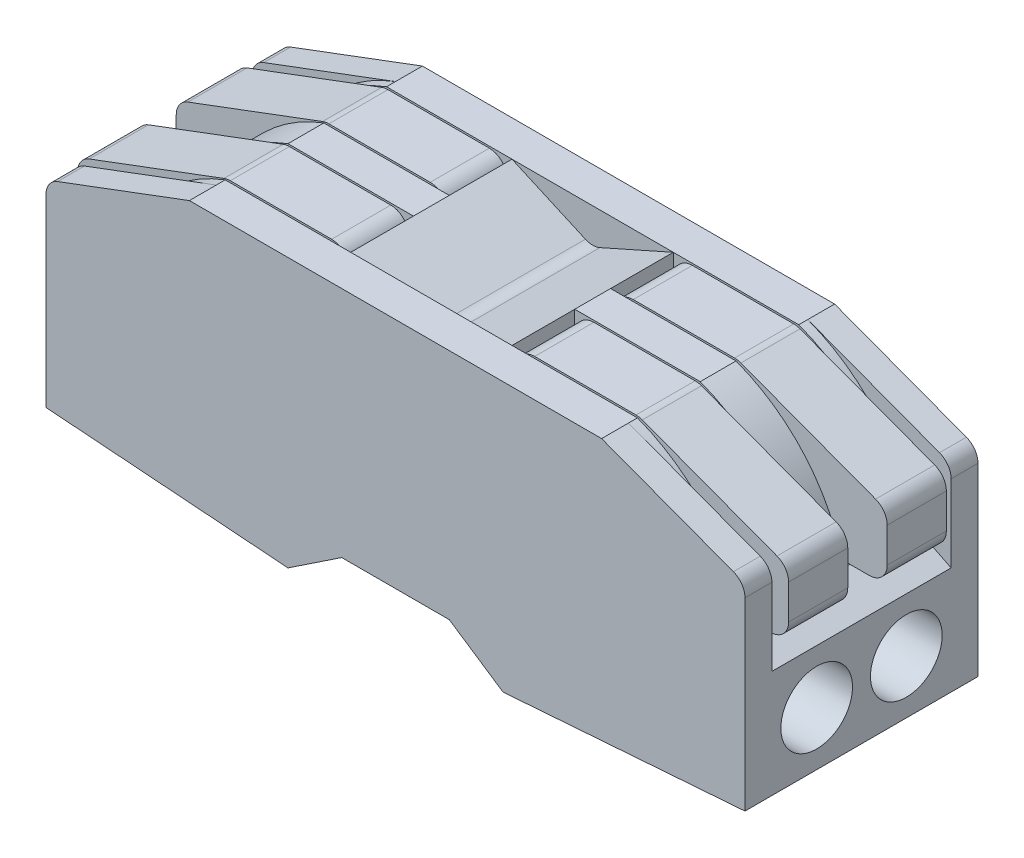
from build123d import *
from OCP.BRepFilletAPI import BRepFilletAPI_MakeChamfer

# Parameters (mm, degrees)
CROQUIS1_W                  = 39
CROQUIS1_H                  = 15
SALIENTE_EXTRUIR1_DEPTH     = 13
CORTAR_EXTRUIR1_DEPTH       = 13
CORTAR_EXTRUIR2_DEPTH       = 25.606909599
CROQUIS4_W                  = 9
CROQUIS4_H                  = 1
CORTAR_EXTRUIR3_DEPTH       = 10
CROQUIS5_W                  = 9
CROQUIS5_H                  = 1
CORTAR_EXTRUIR4_DEPTH       = 10
CORTAR_EXTRUIR5_START       = -2
CORTAR_EXTRUIR5_DEPTH       = 9
CROQUIS7_R                  = 2
CORTAR_EXTRUIR10_DEPTH      = 15
CORTAR_EXTRUIR11_START      = -15
CROQUIS8_R                  = 2
CORTAR_EXTRUIR11_DEPTH      = 15
CROQUIS9_W                  = 15
CROQUIS9_H                  = 3.5
CORTAR_EXTRUIR12_DEPTH      = 7
CORTAR_EXTRUIR13_DEPTH      = 4
CORTAR_EXTRUIR13_DEPTH_BACK = 6
CHAFL_N1_SIZE               = 2
CHAFL_N1_SIZE_2             = 1
SALIENTE_EXTRUIR2_START     = 0.1
SALIENTE_EXTRUIR2_DEPTH     = 3.3
SALIENTE_EXTRUIR2_2_DEPTH   = 3.3
SALIENTE_EXTRUIR3_START     = 2.2
SALIENTE_EXTRUIR3_DEPTH     = 3.3
SALIENTE_EXTRUIR3_2_DEPTH   = 3.3
REDONDEO1_R                 = 1
REDONDEO2_R                 = 1
REDONDEO3_R                 = 1
REDONDEO4_R                 = 1
REDONDEO5_R                 = 1
REDONDEO6_R                 = 1
REDONDEO7_R                 = 1
REDONDEO8_R                 = 1
REDONDEO12_R                = 1
REDONDEO13_R                = 1
REDONDEO14_R                = 1
REDONDEO15_R                = 1
REDONDEO16_R                = 1
REDONDEO17_R                = 1


with BuildPart() as part:
    # Croquis1 → Saliente-Extruir1 (new body)
    with BuildSketch(Plane.XY):
        Rectangle(CROQUIS1_W, CROQUIS1_H)
    extrude(amount=SALIENTE_EXTRUIR1_DEPTH)

    # Croquis2 → Cortar-Extruir1 (cut)
    with BuildSketch(Plane.XY.offset(13)):
        Polygon((0, -5.5), (0, -7.5), (6, -7.5), (3, -5.5), align=None)
        Polygon((-6, -7.5), (0, -7.5), (0, -5.5), (-3, -5.5), align=None)
        Polygon((-19.5, -7.5), (-6, -7.5), (-19.5, -6.5), align=None)
        Polygon((6, -7.5), (19.5, -6.5), (19.5, -7.5), align=None)
    extrude(amount=-CORTAR_EXTRUIR1_DEPTH, mode=Mode.SUBTRACT)

    # Croquis3 → Cortar-Extruir2 (cut, through all)
    with BuildSketch(Plane.XY.offset(13)):
        Polygon((-11.5, 7.5), (-19.5, 4.5), (-19.5, 7.5), align=None)
        Polygon((19.5, 4.5), (19.5, 7.5), (11.5, 7.5), align=None)
    extrude(amount=-CORTAR_EXTRUIR2_DEPTH, mode=Mode.SUBTRACT)

    # Croquis4 → Cortar-Extruir3 (cut)
    with BuildSketch(Plane(origin=(19.5, 0, 0), x_dir=(0, 0, -1), z_dir=(1, 0, 0))):
        with Locations((-6.5, -7)):
            Rectangle(CROQUIS4_W, CROQUIS4_H)
    extrude(amount=-CORTAR_EXTRUIR3_DEPTH, mode=Mode.SUBTRACT)

    # Croquis5 → Cortar-Extruir4 (cut)
    with BuildSketch(Plane.ZY.offset(19.5)):
        with Locations((6.5, -7)):
            Rectangle(CROQUIS5_W, CROQUIS5_H)
    extrude(amount=-CORTAR_EXTRUIR4_DEPTH, mode=Mode.SUBTRACT)

    # Croquis6 → Cortar-Extruir5 (cut)
    with BuildSketch(Plane(origin=(0, 0, 0), x_dir=(-1, 0, 0), z_dir=(0, 0, -1)).offset(CORTAR_EXTRUIR5_START)):
        Polygon((4.5, 7.5), (-4.5, 7.5), (0, 5.5), align=None)
    extrude(amount=-CORTAR_EXTRUIR5_DEPTH, mode=Mode.SUBTRACT)

    # Croquis7 → Cortar-Extruir10 (cut)
    with BuildSketch(Plane.ZY.offset(19.5)):
        with Locations(Location((9, -3.5, 0), (0, 0, 270))):
            Circle(CROQUIS7_R)
        with Locations(Location((4, -3.5, 0), (0, 0, 90))):
            Circle(CROQUIS7_R)
    extrude(amount=-CORTAR_EXTRUIR10_DEPTH, mode=Mode.SUBTRACT)

    # Croquis8 → Cortar-Extruir11 (cut)
    with BuildSketch(Plane(origin=(19.5, 0, 0), x_dir=(0, 0, -1), z_dir=(1, 0, 0)).offset(CORTAR_EXTRUIR11_START)):
        with Locations(Location((-9, -3.5, 0), (0, 0, 270))):
            Circle(CROQUIS8_R)
        with Locations(Location((-4, -3.5, 0), (0, 0, 90))):
            Circle(CROQUIS8_R)
    extrude(amount=CORTAR_EXTRUIR11_DEPTH, mode=Mode.SUBTRACT)

    # Croquis9 → Cortar-Extruir12 (cut)
    with BuildSketch(Plane(origin=(0, 7.5, 0), x_dir=(1, 0, 0), z_dir=(0, 1, 0))):
        with Locations((12, -3.75)):
            Rectangle(CROQUIS9_W, CROQUIS9_H)
        with Locations((-12, -3.75)):
            Rectangle(CROQUIS9_W, CROQUIS9_H)
        with Locations((-12, -9.25)):
            Rectangle(CROQUIS9_W, CROQUIS9_H)
        with Locations((12, -9.25)):
            Rectangle(CROQUIS9_W, CROQUIS9_H)
    extrude(amount=-CORTAR_EXTRUIR12_DEPTH, mode=Mode.SUBTRACT)

    # Croquis10 → Cortar-Extruir13 (cut, two sides: drawn at the far end of the back side and taken through both)
    with BuildSketch(Plane(origin=(0, 0, 5.5), x_dir=(-1, 0, 0), z_dir=(0, 0, -1)).offset(-CORTAR_EXTRUIR13_DEPTH_BACK)):
        with BuildLine():
            Line((17.5, 0.5), (19.5, 0.5))
            Line((19.5, 0.5), (19.5, 4.5))
            Line((19.5, 4.5), (11.5, 7.5))
            ThreePointArc((11.5, 7.5), (15.400036271, 4.771459661), (17.5, 0.5))
        make_face()
        with BuildLine():
            Line((-19.5, 4.5), (-11.5, 7.5))
            ThreePointArc((-11.5, 7.5), (-15.400036271, 4.771459661), (-17.5, 0.5))
            Line((-17.5, 0.5), (-19.5, 0.5))
            Line((-19.5, 0.5), (-19.5, 4.5))
        make_face()
    extrude(amount=CORTAR_EXTRUIR13_DEPTH + CORTAR_EXTRUIR13_DEPTH_BACK, mode=Mode.SUBTRACT)

    # Chaflán1
    chafl_n1_edges_1 = [part.edges().sort_by_distance(p)[0] for p in [
        (-19.5, 0.5, 6.5),
    ]]
    chafl_n1_side_1 = [part.faces().sort_by_distance(p)[0] for p in [
        (-19.48, 0.5, 6.5),
    ]]
    chafl_n1_edges_2 = [part.edges().sort_by_distance(p)[0] for p in [
        (19.5, 0.5, 6.5),
    ]]
    chafl_n1_side_2 = [part.faces().sort_by_distance(p)[0] for p in [
        (19.48, 0.5, 6.5),
    ]]
    chafl_n1 = BRepFilletAPI_MakeChamfer(part.part.solid().wrapped)
    for e in chafl_n1_edges_1:
        chafl_n1.Add(CHAFL_N1_SIZE - 0.0001, CHAFL_N1_SIZE_2 - 0.0001, e.wrapped, chafl_n1_side_1[0].wrapped)
    for e in chafl_n1_edges_2:
        chafl_n1.Add(CHAFL_N1_SIZE - 0.0001, CHAFL_N1_SIZE_2 - 0.0001, e.wrapped, chafl_n1_side_2[0].wrapped)
    add(Compound.cast(chafl_n1.Shape()), mode=Mode.REPLACE)  # a hair under: the kernel refuses the full size

    # Redondeo12
    redondeo12_edges = [part.edges().sort_by_distance(p)[0] for p in [
        (0, 5.5, 6.5),
    ]]
    fillet(redondeo12_edges, radius=REDONDEO12_R)

    # Redondeo13
    redondeo13_edges = [part.edges().sort_by_distance(p)[0] for p in [
        (19.5, 4.5, 12.25),
        (-19.5, 4.5, 12.25),
        (-19.5, 4.5, 0.75),
        (19.5, 4.5, 0.75),
    ]]
    fillet(redondeo13_edges, radius=REDONDEO13_R)


with BuildPart() as body_2:
    # Croquis11 → Saliente-Extruir2 (new body)
    with BuildSketch(Plane.XY.offset(7.5).offset(SALIENTE_EXTRUIR2_START)):
        Polygon((11.5, 7.5), (19.833617862, 4.374893302), (19.833617862, 0.752903639), (4.663883378, 0.752903639), (4.663883378, 7.5), align=None)
    extrude(amount=SALIENTE_EXTRUIR2_DEPTH)

    # Redondeo2
    redondeo2_edges = [body_2.edges().sort_by_distance(p)[0] for p in [
        (4.663883378, 7.5, 9.25),
    ]]
    fillet(redondeo2_edges, radius=REDONDEO2_R)

    # Redondeo7
    redondeo7_edges = [body_2.edges().sort_by_distance(p)[0] for p in [
        (11.5, 7.5, 9.25),
    ]]
    fillet(redondeo7_edges, radius=REDONDEO7_R)

    # Redondeo17
    redondeo17_edges = [body_2.edges().sort_by_distance(p)[0] for p in [
        (19.833617862, 0.752903639, 9.25),
        (19.833617862, 4.374893302, 9.25),
    ]]
    fillet(redondeo17_edges, radius=REDONDEO17_R)


with BuildPart() as body_3:
    # Croquis11 → Saliente-Extruir2 2 (new body)
    with BuildSketch(Plane.XY.offset(7.5).offset(SALIENTE_EXTRUIR2_START)):
        Polygon((-19.833617862, 0.752903639), (-19.833617862, 4.374893302), (-11.5, 7.5), (-4.663883378, 7.5), (-4.663883378, 0.752903639), align=None)
    extrude(amount=SALIENTE_EXTRUIR2_2_DEPTH)

    # Redondeo4
    redondeo4_edges = [body_3.edges().sort_by_distance(p)[0] for p in [
        (-4.663883378, 7.5, 9.25),
    ]]
    fillet(redondeo4_edges, radius=REDONDEO4_R)

    # Redondeo5
    redondeo5_edges = [body_3.edges().sort_by_distance(p)[0] for p in [
        (-11.5, 7.5, 9.25),
    ]]
    fillet(redondeo5_edges, radius=REDONDEO5_R)

    # Redondeo15
    redondeo15_edges = [body_3.edges().sort_by_distance(p)[0] for p in [
        (-19.833617862, 4.374893302, 9.25),
        (-19.833617862, 0.752903639, 9.25),
    ]]
    fillet(redondeo15_edges, radius=REDONDEO15_R)


with BuildPart() as body_4:
    # Croquis12 → Saliente-Extruir3 (new body)
    with BuildSketch(Plane(origin=(0, 0, 7.6), x_dir=(-1, 0, 0), z_dir=(0, 0, -1)).offset(SALIENTE_EXTRUIR3_START)):
        Polygon((11.5, 7.5), (19.833617862, 4.374893302), (19.833617862, 0.752903639), (4.663883378, 0.752903639), (4.663883378, 7.5), align=None)
    extrude(amount=SALIENTE_EXTRUIR3_DEPTH)

    # Redondeo3
    redondeo3_edges = [body_4.edges().sort_by_distance(p)[0] for p in [
        (-4.663883378, 7.5, 3.75),
    ]]
    fillet(redondeo3_edges, radius=REDONDEO3_R)

    # Redondeo6
    redondeo6_edges = [body_4.edges().sort_by_distance(p)[0] for p in [
        (-11.5, 7.5, 3.75),
    ]]
    fillet(redondeo6_edges, radius=REDONDEO6_R)

    # Redondeo14
    redondeo14_edges = [body_4.edges().sort_by_distance(p)[0] for p in [
        (-19.833617862, 0.752903639, 3.75),
        (-19.833617862, 4.374893302, 3.75),
    ]]
    fillet(redondeo14_edges, radius=REDONDEO14_R)


with BuildPart() as body_5:
    # Croquis12 → Saliente-Extruir3 2 (new body)
    with BuildSketch(Plane(origin=(0, 0, 7.6), x_dir=(-1, 0, 0), z_dir=(0, 0, -1)).offset(SALIENTE_EXTRUIR3_START)):
        Polygon((-19.833617862, 0.752903639), (-19.833617862, 4.374893302), (-11.5, 7.5), (-4.663883378, 7.5), (-4.663883378, 0.752903639), align=None)
    extrude(amount=SALIENTE_EXTRUIR3_2_DEPTH)

    # Redondeo1
    redondeo1_edges = [body_5.edges().sort_by_distance(p)[0] for p in [
        (4.663883378, 7.5, 3.75),
    ]]
    fillet(redondeo1_edges, radius=REDONDEO1_R)

    # Redondeo8
    redondeo8_edges = [body_5.edges().sort_by_distance(p)[0] for p in [
        (11.5, 7.5, 3.75),
    ]]
    fillet(redondeo8_edges, radius=REDONDEO8_R)

    # Redondeo16
    redondeo16_edges = [body_5.edges().sort_by_distance(p)[0] for p in [
        (19.833617862, 4.374893302, 3.75),
        (19.833617862, 0.752903639, 3.75),
    ]]
    fillet(redondeo16_edges, radius=REDONDEO16_R)


solid = Compound([part.part, body_2.part, body_3.part, body_4.part, body_5.part])
